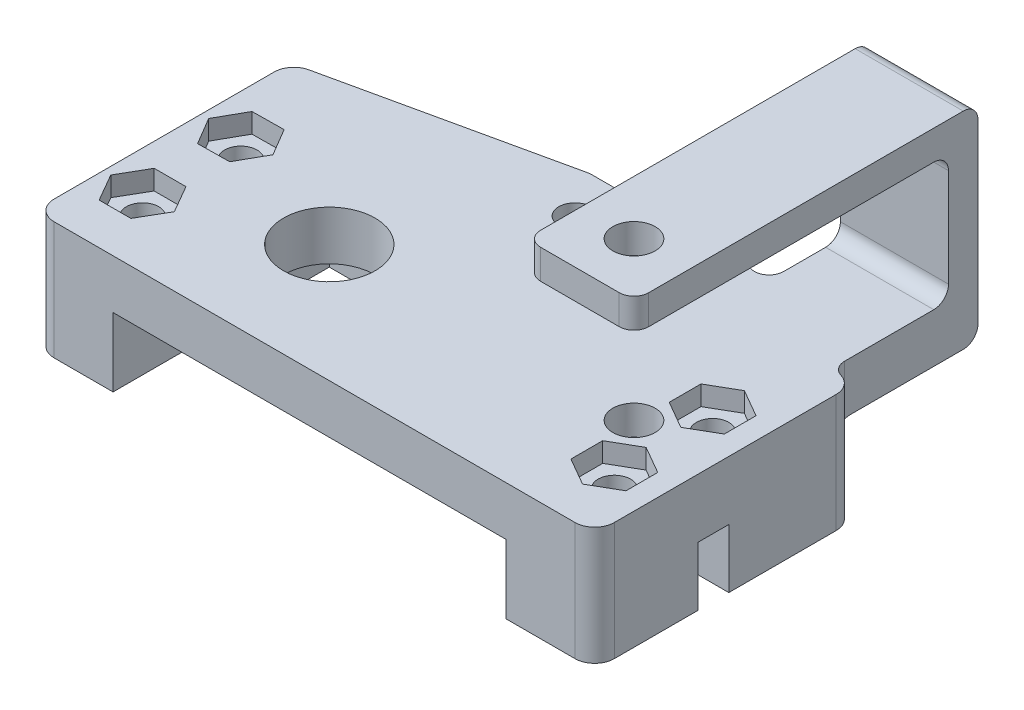
from build123d import *

# Parameters (mm, degrees)
SKETCH_1_R           = 1.6500000000000006
SKETCH_1_R_2         = 1.6500000000000001
SKETCH_1_R_3         = 1.6500000000000028
SKETCH_1_R_4         = 1.6500000000000017
SKETCH_1_R_5         = 1.6499999999999986
SKETCH_1_R_6         = 1.6499999999999955
EXTRUDE_1_DEPTH      = 12
CUT_EXTRUDE_1_DEPTH  = 8
FILLET_1_R           = 2
SKETCH_5_R           = 1.5499999999999978
EXTRUDE_3_DEPTH      = 5
SKETCH_5_R_2         = 1.5500000000000012
EXTRUDE_3_2_DEPTH    = 5
SKETCH_5_R_3         = 4.656253475136203
EXTRUDE_3_3_DEPTH    = 5
SKETCH_7_R           = 3.149999999999999
CUT_EXTRUDE_2_DEPTH  = 2
SKETCH_8_W           = 8
SKETCH_8_H           = 3
SKETCH_8_W_2         = 5.29999999999999
SKETCH_8_H_2         = 3.1337502138362687
CUT_EXTRUDE_3_DEPTH  = 6
SKETCH_6_R           = 1.5499999999999974
SKETCH_6_R_2         = 1.5500000000000012
CUT_EXTRUDE_4_DEPTH  = 10
EXTRUDE_9_DEPTH      = 10
EXTRUDE_9_DEPTH_BACK = 10
SKETCH_18_W          = 11.000000000000007
SKETCH_18_H          = 3
EXTRUDE_10_DEPTH     = 16
SKETCH_19_W          = 11.000000000000007
SKETCH_19_H          = 3
EXTRUDE_11_DEPTH     = 32
SKETCH_20_R          = 2.1500000000000012
CUT_EXTRUDE_7_DEPTH  = 22
FILLET_4_R           = 1.5
CUT_EXTRUDE_8_DEPTH  = 2


with BuildPart() as part:
    # 草图1 → 凸台-拉伸1 (new body)
    with BuildSketch(Plane(origin=(0, 0, 0), x_dir=(1, 0, 0), z_dir=(0, 1, 0))):
        with BuildLine():
            Line((0, 0), (25, 5.5))
            Line((25, 5.5), (41, 5.5))
            Line((41, 5.5), (57, 0))
            Line((57, 0), (57, -26.000000000000004))
            Line((57, -26.000000000000004), (48, -26.000000000000004))
            Line((48, -26.000000000000004), (48, -17.000000000000004))
            ThreePointArc((48, -17.000000000000004), (52.16227766016838, -14.000000000000004), (48, -11.000000000000004))
            Line((48, -11.000000000000004), (48, -4.0000000000000036))
            Line((48, -4.0000000000000036), (8.000000000000004, -4.0000000000000036))
            Line((8.000000000000004, -4.0000000000000036), (8.000000000000004, -26.000000000000004))
            Line((8.000000000000004, -26.000000000000004), (0, -26.000000000000004))
            Line((0, -26.000000000000004), (0, 0))
        make_face()
        with Locations((4.000000000000001, -9.000000000000002)):
            Circle(SKETCH_1_R, mode=Mode.SUBTRACT)
        with Locations((4.000000000000001, -19.000000000000004)):
            Circle(SKETCH_1_R_2, mode=Mode.SUBTRACT)
        with Locations((52.00000000000001, -9.000000000000002)):
            Circle(SKETCH_1_R_3, mode=Mode.SUBTRACT)
        with Locations((52.00000000000001, -19.000000000000004)):
            Circle(SKETCH_1_R_4, mode=Mode.SUBTRACT)
        with Locations((28, 0.9999999999999966)):
            Circle(SKETCH_1_R_5, mode=Mode.SUBTRACT)
        with Locations((38, 0.9999999999999966)):
            Circle(SKETCH_1_R_6, mode=Mode.SUBTRACT)
    extrude(amount=EXTRUDE_1_DEPTH)

    # 草图2 → 切除-拉伸1 (cut)
    with BuildSketch(Plane(origin=(0, 0, 0), x_dir=(-1, 0, 0), z_dir=(0, -1, 0))):
        Polygon((-26.614359353944906, -1.400000000000001), (-25.2287187078898, 1.0000000000000004), (-26.614359353944902, 3.399999999999998), (-29.3856406460551, 3.399999999999998), (-30.771281292110206, 1), (-29.3856406460551, -1.4000000000000015), align=None)
        Polygon((-36.6143593539449, -1.400000000000001), (-35.2287187078898, 1.0000000000000004), (-36.6143593539449, 3.399999999999998), (-39.385640646055094, 3.399999999999998), (-40.7712812921102, 1), (-39.385640646055094, -1.4000000000000015), align=None)
    extrude(amount=-CUT_EXTRUDE_1_DEPTH, mode=Mode.SUBTRACT)

    # 圆角1
    fillet_1_edges = [part.edges().sort_by_distance(p)[0] for p in [
        (57, 6, 26.000000000000004),
        (57, 6, 0),
        (41, 6, -5.5),
        (25, 6, -5.5),
        (0, 6, 0),
        (0, 6, 26.000000000000004),
    ]]
    fillet(fillet_1_edges, radius=FILLET_1_R)

    # 草图8 → 切除-拉伸3 (cut)
    with BuildSketch(Plane(origin=(0, 0, 0), x_dir=(-1, 0, 0), z_dir=(0, -1, 0))):
        with Locations((-4.0000000000000036, -13.662025546184847)):
            Rectangle(SKETCH_8_W, SKETCH_8_H)
        with Locations((-54.35000000000001, -13.920667343602716)):
            Rectangle(SKETCH_8_W_2, SKETCH_8_H_2)
    extrude(amount=-CUT_EXTRUDE_3_DEPTH, mode=Mode.SUBTRACT)



with BuildPart() as body_2:
    # 草图5 → 凸台-拉伸3 (new body)
    with BuildSketch(Plane(origin=(0, 12, 0), x_dir=(1, 0, 0), z_dir=(0, 1, 0))):
        with Locations((28, 0.9999999999999966)):
            Circle(SKETCH_5_R)
    extrude(amount=-EXTRUDE_3_DEPTH)


with BuildPart() as body_3:
    # 草图5 → Extrude 3 2 (new body)
    with BuildSketch(Plane(origin=(0, 12, 0), x_dir=(1, 0, 0), z_dir=(0, 1, 0))):
        with Locations((38, 0.9999999999999966)):
            Circle(SKETCH_5_R_2)
    extrude(amount=-EXTRUDE_3_2_DEPTH)


with BuildPart() as body_4:
    # 草图5 → Extrude 3 3 (new body)
    with BuildSketch(Plane(origin=(0, 12, 0), x_dir=(1, 0, 0), z_dir=(0, 1, 0))):
        with BuildLine():
            Line((48, -11.000000000000004), (48, -4.0000000000000036))
            Line((48, -4.0000000000000036), (8.000000000000004, -4.0000000000000036))
            Line((8.000000000000004, -4.0000000000000036), (8.000000000000004, -26.000000000000004))
            Line((8.000000000000004, -26.000000000000004), (48, -26.000000000000004))
            Line((48, -26.000000000000004), (48, -17.000000000000004))
            ThreePointArc((48, -17.000000000000004), (52.16227766016838, -14.000000000000004), (48, -11.000000000000004))
        make_face()
        with Locations((49, -14.000000000000004)):
            Circle(SKETCH_5_R_2, mode=Mode.SUBTRACT)
        with Locations((18, -14.000000000000002)):
            Circle(SKETCH_5_R_3, mode=Mode.SUBTRACT)
    extrude(amount=-EXTRUDE_3_3_DEPTH)

    # 草图7 → 切除-拉伸2 (cut)
    with BuildSketch(Plane(origin=(0, 7, 0), x_dir=(-1, 0, 0), z_dir=(0, -1, 0))):
        with Locations((-49, -14.000000000000004)):
            Circle(SKETCH_7_R)
    extrude(amount=-CUT_EXTRUDE_2_DEPTH, mode=Mode.SUBTRACT)


with BuildPart() as cut_extrude_4_tool:
    # 草图6 → 切除-拉伸4 (new body)
    with BuildSketch(Plane(origin=(0, 7, 0), x_dir=(-1, 0, 0), z_dir=(0, -1, 0))):
        with Locations((-28, 0.9999999999999966)):
            Circle(SKETCH_6_R)
        with Locations((-38, 0.9999999999999966)):
            Circle(SKETCH_6_R_2)
    extrude(amount=-CUT_EXTRUDE_4_DEPTH)


with BuildPart() as body_2_1:
    add(body_2.part)

    # 切除-拉伸4: cut by cut_extrude_4_tool
    add(cut_extrude_4_tool.part, mode=Mode.SUBTRACT)


with BuildPart() as body_3_1:
    add(body_3.part)

    # 切除-拉伸4: cut by cut_extrude_4_tool
    add(cut_extrude_4_tool.part, mode=Mode.SUBTRACT)


with BuildPart() as part_1:
    add(part.part)

    add(body_4.part)  # 凸台-拉伸9 merges body 4
    # 草图17 → 凸台-拉伸9 (add, two sides: drawn at the far end of the back side and taken through both)
    with BuildSketch(Plane(origin=(0, 0, -5.5), x_dir=(-1, 0, 0), z_dir=(0, 0, -1)).offset(-EXTRUDE_9_DEPTH_BACK)):
        Polygon((-43.5, 12), (-54.5, 11.999999999999998), (-54.5, 6.999999999999999), (-43.5, 9.000000000000002), align=None)
    extrude(amount=EXTRUDE_9_DEPTH + EXTRUDE_9_DEPTH_BACK)

    # 草图18 → 凸台-拉伸10 (add)
    with BuildSketch(Plane(origin=(0, 12, 0), x_dir=(1, 0, 0), z_dir=(0, 1, 0))):
        with Locations((49, 14.000000000000002)):
            Rectangle(SKETCH_18_W, SKETCH_18_H)
    extrude(amount=EXTRUDE_10_DEPTH)

    # 草图19 → 凸台-拉伸11 (add)
    with BuildSketch(Plane.XY.offset(-12.5)):
        with Locations((49, 26.500000000000004)):
            Rectangle(SKETCH_19_W, SKETCH_19_H)
    extrude(amount=EXTRUDE_11_DEPTH)

    # 草图20 → 切除-拉伸7 (cut)
    with BuildSketch(Plane(origin=(0, 28, 0), x_dir=(1, 0, 0), z_dir=(0, 1, 0))):
        with Locations((49, -14.000000000000004)):
            Circle(SKETCH_20_R)
    extrude(amount=-CUT_EXTRUDE_7_DEPTH, mode=Mode.SUBTRACT)

    # 圆角4
    fillet_4_edges = [part_1.edges().sort_by_distance(p)[0] for p in [
        (54.5, 9.499999999999998, -0.8593749999999969),
        (54.5, 26.5, 19.5),
        (43.5, 26.5, 19.5),
        (49, 25, -12.5),
        (49, 28, -15.5),
        (49, 12, -12.5),
        (49, 8, -15.5),
        (49, 8, -2.749999999999998),
        (43.5, 10.5, -4.640624999999999),
    ]]
    fillet(fillet_4_edges, radius=FILLET_4_R)

    # 草图21 → 切除-拉伸8 (cut)
    with BuildSketch(Plane(origin=(0, 12, 0), x_dir=(1, 0, 0), z_dir=(0, 1, 0))):
        Polygon((5.584422554002646, -6.181678069541899), (2.351472889181808, -6.21868885267564), (0.7670503351791655, -9.037010783133738), (2.4155774459973594, -11.8183219304581), (5.648527110818193, -11.781311147324361), (7.232949664820839, -8.96298921686626), align=None)
        Polygon((5.616580753730955, -16.200000000000003), (2.383419246269049, -16.200000000000003), (0.7668384925380971, -19.000000000000004), (2.3834192462690513, -21.800000000000004), (5.616580753730956, -21.800000000000004), (7.233161507461909, -19.000000000000004), align=None)
        Polygon((52.00000000000001, -5.766838492538097), (49.199999999999996, -7.383419246269056), (49.199999999999996, -10.61658075373096), (52, -12.233161507461912), (54.80000000000001, -10.616580753730954), (54.80000000000001, -7.383419246269049), align=None)
        Polygon((52.000000000000014, -15.766838492538099), (49.20000000000002, -17.38341924626905), (49.20000000000002, -20.616580753730954), (52.00000000000002, -22.23316150746191), (54.80000000000002, -20.616580753730958), (54.80000000000002, -17.38341924626905), align=None)
    extrude(amount=-CUT_EXTRUDE_8_DEPTH, mode=Mode.SUBTRACT)


solid = part_1.part
